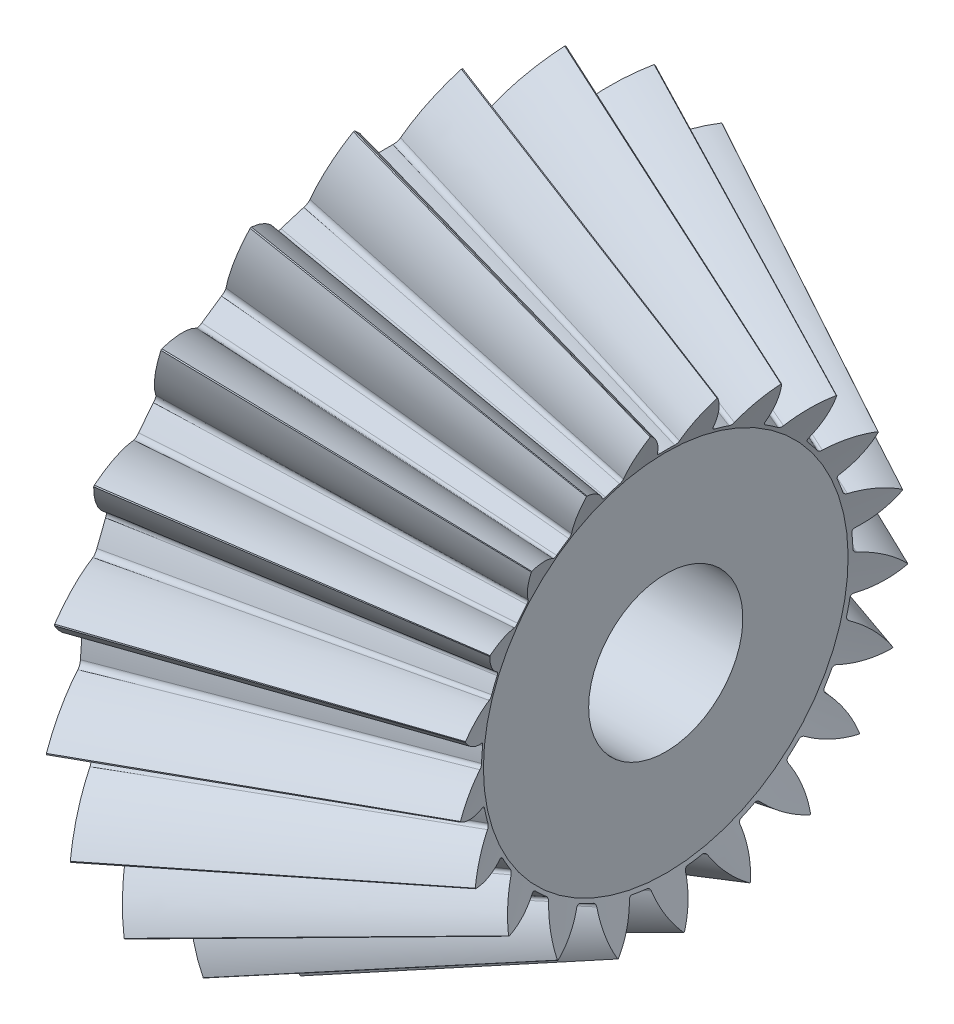
from build123d import *

# Parameters (mm, degrees)
TEETHCUTS_COUNT = 21
TEETHCUTS_ANGLE = 342.857142857
HUBSKE_R        = 9.564320641
HUB_DEPTH       = 0.0001016
BORSKE_R        = 2.5
BORE_DEPTH      = 24.40941052


with BuildPart() as part:
    # BasProSke → Base-Revolve (revolve)
    with BuildSketch(Plane(origin=(0, 0, 0), x_dir=(1, 0, 0), z_dir=(0, 1, 0)), mode=Mode.PRIVATE) as base_revolve_sk:
        Polygon((0, 0), (0, 9.564320641), (0.959264373, 11.756924918), (9.910921394, 7.26892783), (9.317839143, 5.913311258), (9.317839143, 0), align=None)
    revolve(base_revolve_sk.sketch.rotate(Axis((-10, 0, 0), (1, 0, 0)), 180), axis=Axis((-10, 0, 0), (1, 0, 0)))

    # ToothCut: read off the stored shape, not the designer's step
    # ToothCut: loft between two sections, ruled curve by curve
    toothcut_from = [
        Edge.make_bspline([(24.412385692, 0.006916507, -0.010212504), (24.410097065, 0.001685359, -0.014433473), (24.407271361, -0.004773392, -0.013585394), (24.405449273, -0.008938165, -0.008130674)], [0, 0, 0, 0, 1, 1, 1, 1], 3, [1, 0.818252724, 0.818252724, 1]),
        Edge.make_bspline([(24.405449273, -0.008938165, 0.008130674), (24.407271361, -0.004773392, 0.013585394), (24.410097065, 0.001685359, 0.014433473), (24.412385692, 0.006916507, 0.010212504)], [0, 0, 0, 0, 1, 1, 1, 1], 3, [1, 0.818252724, 0.818252724, 1]),
        Edge.make_bspline([(24.405449273, -0.008938165, -0.008130674), (24.405166708, -0.009584028, -0.007284768), (24.404930365, -0.01012424, -0.006354793), (24.404744215, -0.010549725, -0.00535637)], [0, 0, 0, 0, 1, 1, 1, 1], 3, [1, 0.994401128, 0.994401128, 1]),
        Edge.make_bspline([(24.404744215, -0.010549725, 0.00535637), (24.404930365, -0.01012424, 0.006354793), (24.405166708, -0.009584028, 0.007284768), (24.405449273, -0.008938165, 0.008130674)], [0, 0, 0, 0, 1, 1, 1, 1], 3, [1, 0.994401128, 0.994401128, 1]),
        Edge.make_bspline([(24.404744215, -0.010549725, -0.00535637), (24.404100518, -0.012021034, -0.001903868), (24.404100518, -0.012021034, 0.001903868), (24.404744215, -0.010549725, 0.00535637)], [0, 0, 0, 0, 1, 1, 1, 1], 3, [1, 0.937804575, 0.937804575, 1]),
        Edge.make_line((24.412385692, 0.006916507, 0.010212504), (24.412385692, 0.006916507, -0.010212504)),
    ]
    toothcut_to = [
        Edge.make_bspline([(0.990831473, 11.82907829, -1.953949315), (0.767512464, 11.318634843, -1.279788573), (0.472897072, 10.645228233, -0.805824536), (0.134608554, 9.871997336, -0.576496263)], [0, 0, 0, 0, 1, 1, 1, 1], 3, [1, 0.968746533, 0.968746533, 1]),
        Edge.make_bspline([(0.134608554, 9.871997336, 0.576496263), (0.472897072, 10.645228233, 0.805824536), (0.767512464, 11.318634843, 1.279788573), (0.990831473, 11.82907829, 1.953949315)], [0, 0, 0, 0, 1, 1, 1, 1], 3, [1, 0.968746533, 0.968746533, 1]),
        Edge.make_bspline([(0.134608554, 9.871997336, -0.576496263), (0.099080625, 9.790790639, -0.552411618), (0.077308125, 9.741024927, -0.478342976), (0.078777902, 9.744384417, -0.386563975)], [0, 0, 0, 0, 1, 1, 1, 1], 3, [1, 0.854757982, 0.854757982, 1]),
        Edge.make_bspline([(0.078777902, 9.744384417, 0.386563975), (0.077308125, 9.741024927, 0.478342976), (0.099080625, 9.790790639, 0.552411618), (0.134608554, 9.871997336, 0.576496263)], [0, 0, 0, 0, 1, 1, 1, 1], 3, [1, 0.854757982, 0.854757982, 1]),
        Edge.make_bspline([(0.078777902, 9.744384417, -0.386563975), (0.08290384, 9.753815131, -0.128923177), (0.08290384, 9.753815131, 0.128923177), (0.078777902, 9.744384417, 0.386563975)], [0, 0, 0, 0, 1, 1, 1, 1], 3, [1, 0.99946853, 0.99946853, 1]),
        Edge.make_line((0.990831473, 11.82907829, 1.953949315), (0.990831473, 11.82907829, -1.953949315)),
    ]
    toothcut = Solid(Shell([*[Face.make_surface_from_curves(toothcut_from[k], toothcut_to[k]) for k in range(6)], Face(Wire(toothcut_from)), Face(Wire(toothcut_to))]))
    add(toothcut, mode=Mode.SUBTRACT)

    # TeethCuts: ToothCut ×21 about axis
    teethcuts_axis = Axis((-10, 0, 0), (1, 0, 0))
    for i in range(1, TEETHCUTS_COUNT):
        add(toothcut.rotate(teethcuts_axis, i * TEETHCUTS_ANGLE / (TEETHCUTS_COUNT - 1)), mode=Mode.SUBTRACT)

    # HubSke → Hub (add)
    with BuildSketch(Plane.ZY):
        Circle(HUBSKE_R)
    extrude(amount=HUB_DEPTH)

    # BorSke → Bore (cut, symmetric)
    with BuildSketch(Plane(origin=(0, 0, 0), x_dir=(0, 0, -1), z_dir=(1, 0, 0))):
        with Locations(Location((0, 0, 0), (0, 0, 180))):
            Circle(BORSKE_R)
    extrude(amount=BORE_DEPTH, both=True, mode=Mode.SUBTRACT)


solid = part.part
